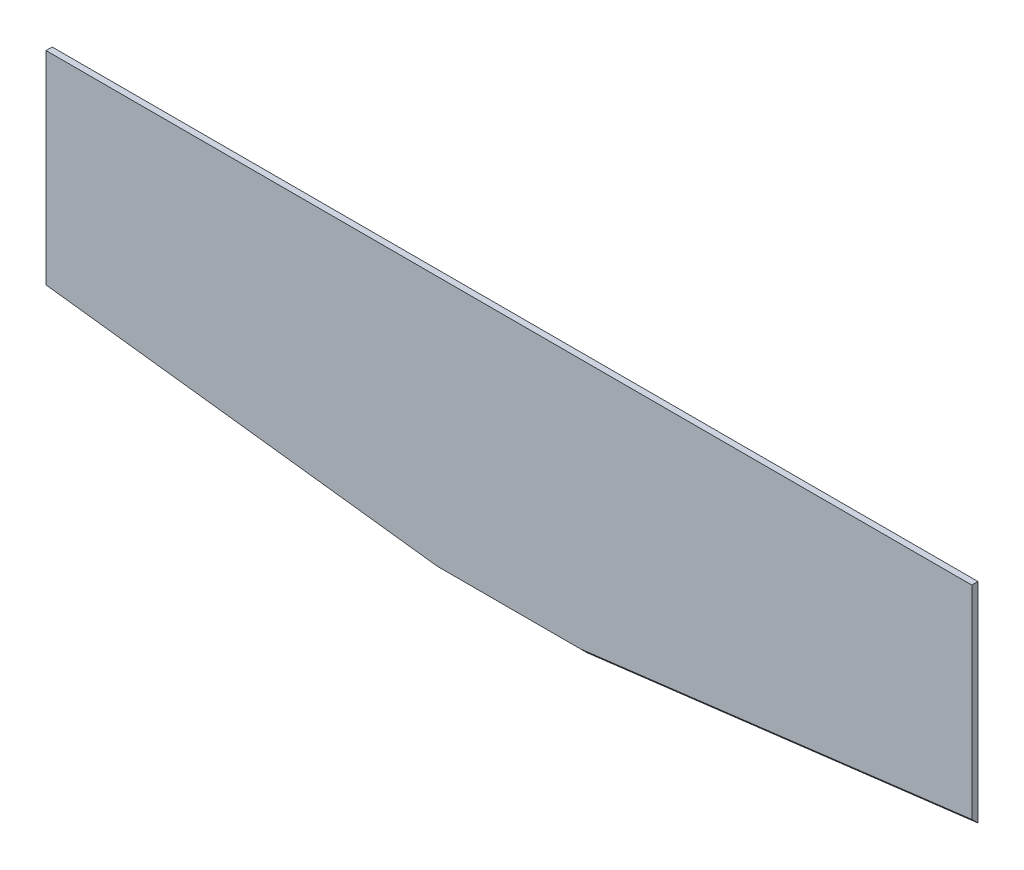
from build123d import *

# Parameters (mm, degrees)
SKETCH_1_W          = 90
SKETCH_1_H          = 25
EXTRUDE_1_DEPTH     = 0.6
CUT_EXTRUDE_1_REACH = 79.668
CHAMFER_1_SIZE      = 0.6


with BuildPart() as part:
    # 草图1 → 凸台-拉伸1 (new body)
    with BuildSketch(Plane.XY):
        with Locations((31, -3.5)):
            Rectangle(SKETCH_1_W, SKETCH_1_H)
    extrude(amount=EXTRUDE_1_DEPTH)

    # 草图2 → 切除-拉伸1 (cut, up to next)
    with BuildSketch(Plane.XY.offset(0.6), mode=Mode.PRIVATE) as cut_extrude_1_sk1:
        Polygon((24, -16), (-14, -11.334186686), (-14, -16), align=None)
    cut_extrude_1_tool1 = extrude(cut_extrude_1_sk1.sketch, amount=-CUT_EXTRUDE_1_REACH, mode=Mode.PRIVATE) & part.part
    # 草图2 → 切除-拉伸1 (cut, up to next)
    with BuildSketch(Plane.XY.offset(0.6), mode=Mode.PRIVATE) as cut_extrude_1_sk2:
        Polygon((76, -11.334186686), (76, -16), (38, -16), align=None)
    cut_extrude_1_tool2 = extrude(cut_extrude_1_sk2.sketch, amount=-CUT_EXTRUDE_1_REACH, mode=Mode.PRIVATE) & part.part
    add(cut_extrude_1_tool1.solids().sort_by_distance((-1.333333, -14.444729, 0.6))[0], mode=Mode.SUBTRACT)
    add(cut_extrude_1_tool2.solids().sort_by_distance((63.333333, -14.444729, 0.6))[0], mode=Mode.SUBTRACT)

    # 倒角1
    chamfer_1_edges = [part.edges().sort_by_distance(p)[0] for p in [
        (57, -13.667093343, 0.6),
        (5, -13.667093343, 0.6),
        (31, -16, 0.6),
    ]]
    chamfer(chamfer_1_edges, length=CHAMFER_1_SIZE - 0.0001)  # a hair under: the kernel refuses the full size


solid = part.part
